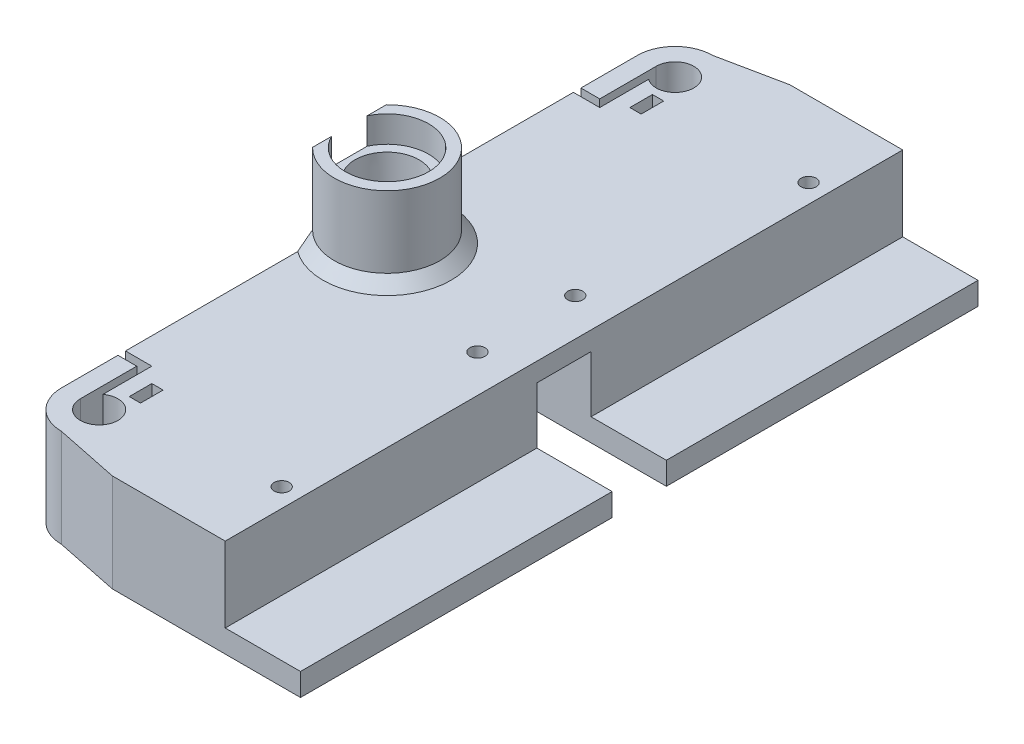
from build123d import *

# Parameters (mm, degrees)
DODANIE_WYCI_GNI_CIE1_DEPTH = 180
SZKIC2_R                    = 4
SZKIC2_R_2                  = 5
DODANIE_WYCI_GNI_CIE2_DEPTH = 26
WYTNIJ_WYCI_GNI_CIE1_DEPTH  = 26
SZKIC4_R                    = 1.75
WYTNIJ_WYCI_GNI_CIE2_DEPTH  = 11
WYTNIJ_WYCI_GNI_CIE3_START  = -11
WYTNIJ_WYCI_GNI_CIE3_DEPTH  = 3
DODANIE_WYCI_GNI_CIE3_START = -2
DODANIE_WYCI_GNI_CIE3_DEPTH = 2
WYTNIJ_WYCI_GNI_CIE5_DEPTH  = 21
SZKIC8_W                    = 13
SZKIC8_H                    = 9
SZKIC8_R                    = 2
WYTNIJ_WYCI_GNI_CIE6_DEPTH  = 4
DODANIE_WYCI_GNI_CIE4_START = 22
SZKIC9_R                    = 14
SZKIC9_R_2                  = 4
DODANIE_WYCI_GNI_CIE4_DEPTH = 22
SZKIC10_R                   = 11.05
SZKIC10_R_2                 = 4
WYTNIJ_WYCI_GNI_CIE7_DEPTH  = 7
SZKIC11_R                   = 8
SZKIC11_R_2                 = 4
WYTNIJ_WYCI_GNI_CIE8_DEPTH  = 15
SFAZOWANIE1_SIZE            = 0.5
SFAZOWANIE1_SIZE2           = 12
WYTNIJ_WYCI_GNI_CIE9_START  = 22
WYTNIJ_WYCI_GNI_CIE9_DEPTH  = 22
WYTNIJ_WYCI_GNI_CIE10_START = -3
SZKIC13_R                   = 4
WYTNIJ_WYCI_GNI_CIE10_DEPTH = 3
SZKIC14_R                   = 2
WYTNIJ_WYCI_GNI_CIE11_DEPTH = 6
SZKIC15_R                   = 2
WYTNIJ_WYCI_GNI_CIE12_DEPTH = 6
SFAZOWANIE2_SIZE            = 3


with BuildPart() as part:
    # Szkic1 → Dodanie-wyciągnięcie1 (new body)
    with BuildSketch(Plane.XY):
        Polygon((10, -16), (10, -10), (-10, -10), (-10, 10), (-40, 10), (-40, -16), align=None)
    extrude(amount=DODANIE_WYCI_GNI_CIE1_DEPTH)

    # Szkic2 → Dodanie-wyciągnięcie2 (add)
    with BuildSketch(Plane(origin=(0, 10, 0), x_dir=(1, 0, 0), z_dir=(0, 1, 0))):
        with BuildLine():
            Line((-40, -180), (-40, 0))
            Line((-40, 0), (-57, -3.5))
            ThreePointArc((-57, -3.5), (-64.071067812, -6.428932188), (-67, -13.5))
            Line((-67, -13.5), (-67, -166.5))
            ThreePointArc((-67, -166.5), (-64.071067812, -173.571067812), (-57, -176.5))
            Line((-57, -176.5), (-40, -180))
        make_face()
        with Locations((-57, -90)):
            Circle(SZKIC2_R, mode=Mode.SUBTRACT)
        with Locations((-57, -166.5)):
            Circle(SZKIC2_R_2, mode=Mode.SUBTRACT)
        with Locations((-57, -13.5)):
            Circle(SZKIC2_R_2, mode=Mode.SUBTRACT)
    extrude(amount=-DODANIE_WYCI_GNI_CIE2_DEPTH)

    # Szkic3 → Wytnij-wyciągnięcie1 (cut)
    with BuildSketch(Plane(origin=(0, 10, 0), x_dir=(1, 0, 0), z_dir=(0, 1, 0))):
        with BuildLine():
            ThreePointArc((-60, -17.5), (-61.472135955, -15.736067977), (-62, -13.5))
            Line((-62, -13.5), (-62, -28.5))
            Line((-62, -28.5), (-67, -28.5))
            Line((-67, -28.5), (-67, -30.5))
            Line((-67, -30.5), (-60, -30.5))
            Line((-60, -30.5), (-60, -17.5))
        make_face()
    wytnij_wyci_gni_cie1 = extrude(amount=-WYTNIJ_WYCI_GNI_CIE1_DEPTH, mode=Mode.SUBTRACT)

    # Szkic4 → Wytnij-wyciągnięcie2 (cut)
    with BuildSketch(Plane.ZY.offset(67)):
        with Locations((23.5, 3)):
            Circle(SZKIC4_R)
        with Locations((23.5, -9)):
            Circle(SZKIC4_R)
    wytnij_wyci_gni_cie2 = extrude(amount=-WYTNIJ_WYCI_GNI_CIE2_DEPTH, mode=Mode.SUBTRACT)

    # Szkic5 → Wytnij-wyciągnięcie3 (cut)
    with BuildSketch(Plane.ZY.offset(67).offset(WYTNIJ_WYCI_GNI_CIE3_START)):
        Polygon((20.5, 10), (20.5, 1.267949192), (23.5, -0.464101615), (26.5, 1.267949192), (26.5, 10), align=None)
        Polygon((26.5, -7.267949192), (23.5, -5.535898385), (20.5, -7.267949192), (20.5, -16), (26.5, -16), align=None)
    wytnij_wyci_gni_cie3 = extrude(amount=-WYTNIJ_WYCI_GNI_CIE3_DEPTH, mode=Mode.SUBTRACT)

    # Szkic6 → Dodanie-wyciągnięcie3 (add)
    with BuildSketch(Plane.XZ.offset(16).offset(DODANIE_WYCI_GNI_CIE3_START)):
        with BuildLine():
            Line((-57, 18.5), (-57, 8.5))
            ThreePointArc((-57, 8.5), (-52, 13.5), (-57, 18.5))
        make_face()
    dodanie_wyci_gni_cie3 = extrude(amount=DODANIE_WYCI_GNI_CIE3_DEPTH)

    # Lustro1: Wytnij-wyciągnięcie1, Wytnij-wyciągnięcie2, Wytnij-wyciągnięcie3, Dodanie-wyciągnięcie3 across plane
    add(wytnij_wyci_gni_cie1.mirror(Plane.XY.offset(90)), mode=Mode.SUBTRACT)
    add(wytnij_wyci_gni_cie2.mirror(Plane.XY.offset(90)), mode=Mode.SUBTRACT)
    add(wytnij_wyci_gni_cie3.mirror(Plane.XY.offset(90)), mode=Mode.SUBTRACT)
    add(dodanie_wyci_gni_cie3.mirror(Plane.XY.offset(90)))

    # Szkic7 → Wytnij-wyciągnięcie5 (cut)
    with BuildSketch(Plane.XZ.offset(16)):
        with BuildLine():
            ThreePointArc((-60, 97.2), (-62.121320344, 96.321320344), (-63, 94.2))
            Line((-63, 94.2), (-63, 85.8))
            ThreePointArc((-63, 85.8), (-62.121320344, 83.678679656), (-60, 82.8))
            Line((-60, 82.8), (-55.2, 82.8))
            ThreePointArc((-55.2, 82.8), (-51.7, 79.3), (-48.2, 82.8))
            Line((-48.2, 82.8), (11.571529958, 82.8))
            Line((11.571529958, 82.8), (11.571529958, 97.2))
            Line((11.571529958, 97.2), (-48.2, 97.2))
            ThreePointArc((-48.2, 97.2), (-51.7, 100.7), (-55.2, 97.2))
            Line((-55.2, 97.2), (-60, 97.2))
        make_face()
    extrude(amount=-WYTNIJ_WYCI_GNI_CIE5_DEPTH, mode=Mode.SUBTRACT)

    # Szkic8 → Wytnij-wyciągnięcie6 (cut)
    with BuildSketch(Plane.XZ.offset(-5)):
        with Locations((-41.7, 90)):
            Rectangle(SZKIC8_W, SZKIC8_H)
        with Locations((-51.7, 97.2)):
            Circle(SZKIC8_R)
        with Locations((-51.7, 82.8)):
            Circle(SZKIC8_R)
    extrude(amount=-WYTNIJ_WYCI_GNI_CIE6_DEPTH, mode=Mode.SUBTRACT)

    # Szkic9 → Dodanie-wyciągnięcie4 (add)
    with BuildSketch(Plane(origin=(0, 10, 0), x_dir=(1, 0, 0), z_dir=(0, 1, 0)).offset(DODANIE_WYCI_GNI_CIE4_START)):
        with Locations((-57, -90)):
            Circle(SZKIC9_R)
        with Locations((-57, -90)):
            Circle(SZKIC9_R_2, mode=Mode.SUBTRACT)
    extrude(amount=-DODANIE_WYCI_GNI_CIE4_DEPTH)

    # Szkic10 → Wytnij-wyciągnięcie7 (cut)
    with BuildSketch(Plane(origin=(0, 32, 0), x_dir=(1, 0, 0), z_dir=(0, 1, 0))):
        with Locations((-57, -90)):
            Circle(SZKIC10_R)
        with Locations((-57, -90)):
            Circle(SZKIC10_R_2, mode=Mode.SUBTRACT)
    extrude(amount=-WYTNIJ_WYCI_GNI_CIE7_DEPTH, mode=Mode.SUBTRACT)

    # Szkic11 → Wytnij-wyciągnięcie8 (cut)
    with BuildSketch(Plane(origin=(0, 25, 0), x_dir=(1, 0, 0), z_dir=(0, 1, 0))):
        with Locations((-57, -90)):
            Circle(SZKIC11_R)
        with Locations((-57, -90)):
            Circle(SZKIC11_R_2, mode=Mode.SUBTRACT)
    extrude(amount=-WYTNIJ_WYCI_GNI_CIE8_DEPTH, mode=Mode.SUBTRACT)

    # Sfazowanie1
    sfazowanie1_edges = [part.edges().sort_by_distance(p)[0] for p in [
        (-65, 25, 90),
    ]]
    sfazowanie1_side = [part.faces().sort_by_distance(p)[0] for p in [
        (-67.737458803, 25, 90),
    ]]
    chamfer(sfazowanie1_edges, length=SFAZOWANIE1_SIZE, length2=SFAZOWANIE1_SIZE2, reference=sfazowanie1_side[0])

    # Szkic12 → Wytnij-wyciągnięcie9 (cut)
    with BuildSketch(Plane(origin=(0, 10, 0), x_dir=(1, 0, 0), z_dir=(0, 1, 0)).offset(WYTNIJ_WYCI_GNI_CIE9_START)):
        with BuildLine():
            Line((-67, -99.797958971), (-67, -80.202041029))
            ThreePointArc((-67, -80.202041029), (-71, -90), (-67, -99.797958971))
        make_face()
    extrude(amount=-WYTNIJ_WYCI_GNI_CIE9_DEPTH, mode=Mode.SUBTRACT)

    # Szkic13 → Wytnij-wyciągnięcie10 (cut)
    with BuildSketch(Plane.XZ.offset(16).offset(WYTNIJ_WYCI_GNI_CIE10_START)):
        with BuildLine():
            Line((-60, 104.2), (-30, 104.2))
            ThreePointArc((-30, 104.2), (-26.464466094, 102.735533906), (-25, 99.2))
            Line((-25, 99.2), (-25, 80.8))
            ThreePointArc((-25, 80.8), (-26.464466094, 77.264466094), (-30, 75.8))
            Line((-30, 75.8), (-60, 75.8))
            ThreePointArc((-60, 75.8), (-63.535533906, 77.264466094), (-65, 80.8))
            Line((-65, 80.8), (-65, 99.2))
            ThreePointArc((-65, 99.2), (-63.535533906, 102.735533906), (-60, 104.2))
        make_face()
        with Locations((-57, 90)):
            Circle(SZKIC13_R, mode=Mode.SUBTRACT)
    extrude(amount=WYTNIJ_WYCI_GNI_CIE10_DEPTH, mode=Mode.SUBTRACT)

    # Szkic14 → Wytnij-wyciągnięcie11 (cut)
    with BuildSketch(Plane.XZ.offset(13)):
        with Locations((-60, 101.2)):
            Circle(SZKIC14_R)
        with Locations((-30, 101.2)):
            Circle(SZKIC14_R)
        with Locations((-30, 78.8)):
            Circle(SZKIC14_R)
        with Locations((-60, 78.8)):
            Circle(SZKIC14_R)
    extrude(amount=-WYTNIJ_WYCI_GNI_CIE11_DEPTH, mode=Mode.SUBTRACT)

    # Szkic15 → Wytnij-wyciągnięcie12 (cut)
    with BuildSketch(Plane(origin=(0, 10, 0), x_dir=(1, 0, 0), z_dir=(0, 1, 0))):
        with Locations((-15, -160)):
            Circle(SZKIC15_R)
        with Locations((-20, -103)):
            Circle(SZKIC15_R)
        with Locations((-15, -20)):
            Circle(SZKIC15_R)
        with Locations((-20, -77)):
            Circle(SZKIC15_R)
    extrude(amount=-WYTNIJ_WYCI_GNI_CIE12_DEPTH, mode=Mode.SUBTRACT)

    # Sfazowanie2
    sfazowanie2_edges = [part.edges().sort_by_distance(p)[0] for p in [
        (-43, 10, 90),
    ]]
    chamfer(sfazowanie2_edges, length=SFAZOWANIE2_SIZE)


solid = part.part
